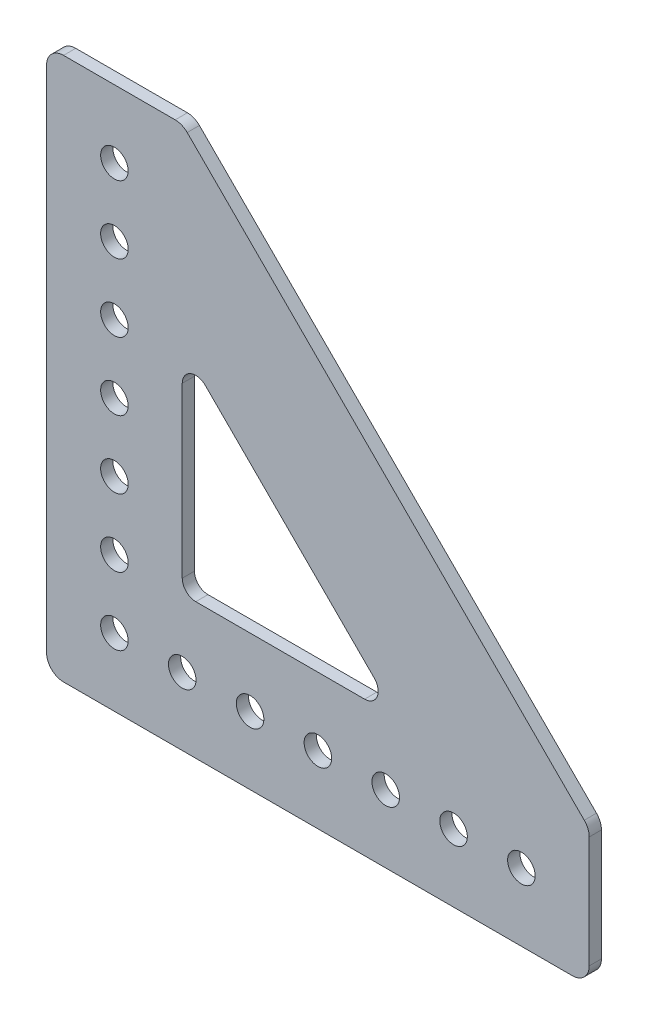
from build123d import *

# Parameters (mm, degrees)
SKETCH1_R           = 2.5781
BOSS_EXTRUDE1_DEPTH = 1.143
FILLET1_R           = 3.175
CUT_EXTRUDE1_DEPTH  = 2.54


with BuildPart() as part:
    # Sketch1 → Boss-Extrude1 (new, symmetric)
    with BuildSketch(Plane.XY):
        Polygon((43.046315789, -67.510526316), (43.046315789, -42.110526316), (-33.153684211, 34.089473684), (-58.553684211, 34.089473684), (-58.553684211, -67.510526316), align=None)
        with Locations((-45.853684211, 21.389473684)):
            Circle(SKETCH1_R, mode=Mode.SUBTRACT)
        with Locations((-45.853684211, 8.689473684)):
            Circle(SKETCH1_R, mode=Mode.SUBTRACT)
        with Locations((-45.853684211, -4.010526316)):
            Circle(SKETCH1_R, mode=Mode.SUBTRACT)
        with Locations((-45.853684211, -16.710526316)):
            Circle(SKETCH1_R, mode=Mode.SUBTRACT)
        with Locations((-33.153684211, -54.810526316)):
            Circle(SKETCH1_R, mode=Mode.SUBTRACT)
        with Locations((-20.453684211, -54.810526316)):
            Circle(SKETCH1_R, mode=Mode.SUBTRACT)
        with Locations((-7.753684211, -54.810526316)):
            Circle(SKETCH1_R, mode=Mode.SUBTRACT)
        with Locations((-45.853684211, -29.410526316)):
            Circle(SKETCH1_R, mode=Mode.SUBTRACT)
        with Locations((-45.853684211, -42.110526316)):
            Circle(SKETCH1_R, mode=Mode.SUBTRACT)
        with Locations((-45.853684211, -54.810526316)):
            Circle(SKETCH1_R, mode=Mode.SUBTRACT)
        with Locations((4.946315789, -54.810526316)):
            Circle(SKETCH1_R, mode=Mode.SUBTRACT)
        with Locations((17.646315789, -54.810526316)):
            Circle(SKETCH1_R, mode=Mode.SUBTRACT)
        with Locations((30.346315789, -54.810526316)):
            Circle(SKETCH1_R, mode=Mode.SUBTRACT)
    extrude(amount=BOSS_EXTRUDE1_DEPTH, both=True)

    # Fillet1
    fillet1_edges = [part.edges().sort_by_distance(p)[0] for p in [
        (-58.553684211, 34.089473684, 0),
        (43.046315789, -42.110526316, 0),
        (43.046315789, -67.510526316, 0),
        (-58.553684211, -67.510526316, 0),
        (-33.153684211, 34.089473684, 0),
    ]]
    fillet(fillet1_edges, radius=FILLET1_R)

    # Sketch2 → Cut-Extrude1 (cut)
    with BuildSketch(Plane.XY.offset(1.143)):
        with BuildLine():
            Line((-33.153684211, -7.963653248), (-33.153684211, -39.570526316))
            ThreePointArc((-33.153684211, -39.570526316), (-32.409735435, -41.36657754), (-30.613684211, -42.110526316))
            Line((-30.613684211, -42.110526316), (0.993188857, -42.110526316))
            ThreePointArc((0.993188857, -42.110526316), (3.339842869, -40.542542234), (2.789240081, -37.774475092))
            Line((2.789240081, -37.774475092), (-28.817632986, -6.167602024))
            ThreePointArc((-28.817632986, -6.167602024), (-31.585700129, -5.616999236), (-33.153684211, -7.963653248))
        make_face()
    extrude(amount=-CUT_EXTRUDE1_DEPTH, mode=Mode.SUBTRACT)


solid = part.part
